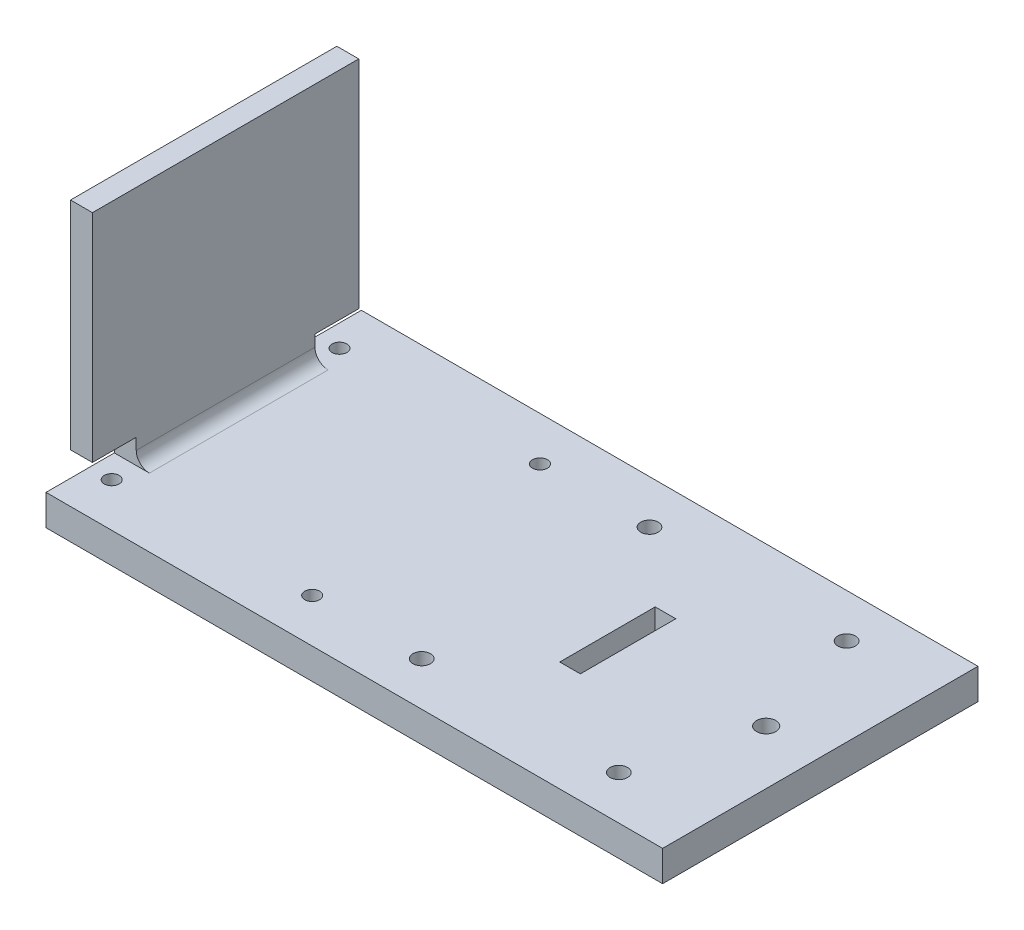
from build123d import *

# Parameters (mm, degrees)
EXTRUDE_2_OUTLINE_W   = 140.770566096
EXTRUDE_2_OUTLINE_H   = 72
EXTRUDE_2_OUTLINE_R   = 1.7
EXTRUDE_2_OUTLINE_W_2 = 4.7
EXTRUDE_2_OUTLINE_H_2 = 21.788461539
EXTRUDE_2_OUTLINE_R_2 = 2.2
EXTRUDE_2_DEPTH       = 7
SKETCH_2_R            = 2.9
SKETCH_2_R_2          = 4.8
CUT_EXTRUDE_1_DEPTH   = 3
EXTRUDE_3_DEPTH       = 5
FILLET_1_R            = 3
SKETCH_4_R            = 2
CUT_EXTRUDE_2_DEPTH   = 159.482615774


# Read off the part's stored shape, not the designer's step: 填料-伸長2
with BuildPart() as part:
    # 填料-伸長2 outline → 填料-伸長2 (new body)
    with BuildSketch(Plane.XZ.offset(5.158117597)):
        with Locations((-64.32262294, -19.915289206)):
            Rectangle(EXTRUDE_2_OUTLINE_W, EXTRUDE_2_OUTLINE_H)
        with Locations((-129.707905988, -45.915289206)):
            Circle(EXTRUDE_2_OUTLINE_R, mode=Mode.SUBTRACT)
        with Locations((-83.937339892, -45.915289206)):
            Circle(EXTRUDE_2_OUTLINE_R, mode=Mode.SUBTRACT)
        with Locations((-40.175495169, -19.915289206)):
            Rectangle(EXTRUDE_2_OUTLINE_W_2, EXTRUDE_2_OUTLINE_H_2, mode=Mode.SUBTRACT)
        with Locations((-129.707905988, 6.084710794)):
            Circle(EXTRUDE_2_OUTLINE_R, mode=Mode.SUBTRACT)
        with Locations((-83.937339892, 6.084710794)):
            Circle(EXTRUDE_2_OUTLINE_R, mode=Mode.SUBTRACT)
        with Locations((-6.29428449, -19.915289206)):
            Circle(EXTRUDE_2_OUTLINE_R_2, mode=Mode.SUBTRACT)
    extrude(amount=EXTRUDE_2_DEPTH)

    # 草圖2 → 除料-伸長1 (cut)
    with BuildSketch(Plane.XZ.offset(12.158117597)):
        with Locations(Location((-129.707905988, -45.915289206, 0), (0, 0, 270))):
            Circle(SKETCH_2_R)
        with Locations(Location((-129.707905988, 6.084710794, 0), (0, 0, 270))):
            Circle(SKETCH_2_R)
        with Locations(Location((-83.937339892, 6.084710794, 0), (0, 0, 270))):
            Circle(SKETCH_2_R)
        with Locations(Location((-83.937339892, -45.915289206, 0), (0, 0, 270))):
            Circle(SKETCH_2_R)
        with Locations(Location((-6.29428449, -19.915289206, 0), (0, 0, 270))):
            Circle(SKETCH_2_R_2)
    extrude(amount=-CUT_EXTRUDE_1_DEPTH, mode=Mode.SUBTRACT)

    # 草圖3 → 填料-伸長3 (add)
    with BuildSketch(Plane.ZY.offset(134.707905988)):
        Polygon((0.484710794, -5.158117597), (-40.315289206, -5.158117597), (-40.315289206, 0.441882403), (-40.915289206, 0.441882403), (-50.315289206, 0.441882403), (-50.315289206, 49.841882403), (10.484710794, 49.841882403), (10.484710794, 0.441882403), (1.084710794, 0.441882403), (0.484710794, 0.441882403), align=None)
    extrude(amount=-EXTRUDE_3_DEPTH)

    # 圓角1
    fillet_1_edges = [part.edges().sort_by_distance(p)[0] for p in [
        (-129.707905988, -5.158117597, -19.915289206),
    ]]
    fillet(fillet_1_edges, radius=FILLET_1_R)

    # 草圖4 → 除料-伸長2 (cut, through all)
    with BuildSketch(Plane.XZ.offset(12.158117597)):
        with Locations(Location((-58.937339892, 6.084710794, 0), (0, 0, 270))):
            Circle(SKETCH_4_R)
        with Locations(Location((-13.937339892, 6.084710794, 0), (0, 0, 270))):
            Circle(SKETCH_4_R)
        with Locations(Location((-13.937339892, -45.915289206, 0), (0, 0, 270))):
            Circle(SKETCH_4_R)
        with Locations(Location((-58.937339892, -45.915289206, 0), (0, 0, 270))):
            Circle(SKETCH_4_R)
    extrude(amount=-CUT_EXTRUDE_2_DEPTH, mode=Mode.SUBTRACT)


solid = part.part
